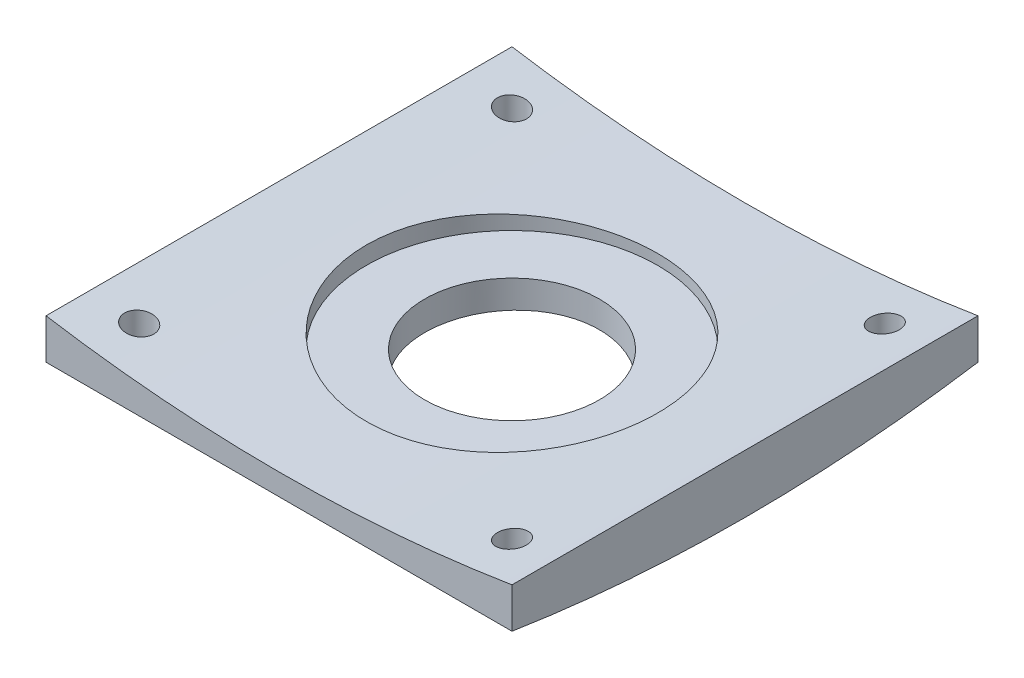
from build123d import *
from build123d.topology import SkipClean

# Parameters (mm, degrees)
SKETCH1_3_W         = 80
SKETCH1_3_H         = 80
SKETCH1_3_R         = 2.5
SKETCH1_3_R_2       = 15
BOSS_EXTRUDE3_DEPTH = 5
BOSS_EXTRUDE4_START = 5
SKETCH1_W           = 80
SKETCH1_H           = 80
SKETCH1_R           = 2.5
SKETCH1_R_2         = 25
BOSS_EXTRUDE4_DEPTH = 5
CUT_EXTRUDE1_DEPTH  = 90.582364336
CUT_EXTRUDE2_DEPTH  = 90.582364475
CUT_EXTRUDE3_DEPTH  = 90.582364475


with BuildPart() as part:
    # Sketch1<3> → Boss-Extrude3 (new body)
    with BuildSketch(Plane(origin=(0, 0, 0), x_dir=(1, 0, 0), z_dir=(0, 1, 0))):
        Rectangle(SKETCH1_3_W, SKETCH1_3_H)
        with Locations((-32, -32)):
            Circle(SKETCH1_3_R, mode=Mode.SUBTRACT)
        with Locations((32, -32)):
            Circle(SKETCH1_3_R, mode=Mode.SUBTRACT)
        with Locations((-32, 32)):
            Circle(SKETCH1_3_R, mode=Mode.SUBTRACT)
        with Locations((32, 32)):
            Circle(SKETCH1_3_R, mode=Mode.SUBTRACT)
        Circle(SKETCH1_3_R_2, mode=Mode.SUBTRACT)
    extrude(amount=-BOSS_EXTRUDE3_DEPTH)

    # Sketch1 → Boss-Extrude4 (add)
    with BuildSketch(Plane(origin=(0, 0, 0), x_dir=(1, 0, 0), z_dir=(0, 1, 0)).offset(BOSS_EXTRUDE4_START)):
        Rectangle(SKETCH1_W, SKETCH1_H)
        with Locations((-32, -32)):
            Circle(SKETCH1_R, mode=Mode.SUBTRACT)
        with Locations((32, -32)):
            Circle(SKETCH1_R, mode=Mode.SUBTRACT)
        Circle(SKETCH1_R_2, mode=Mode.SUBTRACT)
        with Locations((-32, 32)):
            Circle(SKETCH1_R, mode=Mode.SUBTRACT)
        with Locations((32, 32)):
            Circle(SKETCH1_R, mode=Mode.SUBTRACT)
    extrude(amount=-BOSS_EXTRUDE4_DEPTH)

    # Sketch5 → Cut-Extrude1 (cut, through all)
    with BuildSketch(Plane(origin=(0, 0, -40), x_dir=(-1, 0, 0), z_dir=(0, 0, -1))):
        with BuildLine():
            Line((40, 5), (-40, 5))
            ThreePointArc((-40, 5), (0, 1.779253585), (40, 5))
        make_face()
    extrude(amount=-CUT_EXTRUDE1_DEPTH, mode=Mode.SUBTRACT)

    # Sketch7 → Cut-Extrude2 (cut, through all)
    with BuildSketch(Plane(origin=(40, 0, 0), x_dir=(0, 0, -1), z_dir=(1, 0, 0))):
        with BuildLine():
            ThreePointArc((0, -5), (-20.059793007, -4.225007869), (-40, -1.904651573))
            Line((-40, -1.904651573), (-40, -5))
            Line((-40, -5), (0, -5))
        make_face()
    extrude(amount=-CUT_EXTRUDE2_DEPTH, mode=Mode.SUBTRACT)

    # Sketch7<3> → Cut-Extrude3 (cut, through all)
    with SkipClean():  # the faces are left unmerged after this step: merging them gives an invalid solid
        with BuildSketch(Plane(origin=(40, 0, 0), x_dir=(0, 0, -1), z_dir=(1, 0, 0))):
            with BuildLine():
                ThreePointArc((40, -1.904651573), (20.059793007, -4.225007869), (0, -5))
                Line((0, -5), (40, -5))
                Line((40, -5), (40, -1.904651573))
            make_face()
        extrude(amount=-CUT_EXTRUDE3_DEPTH, mode=Mode.SUBTRACT)


solid = part.part
